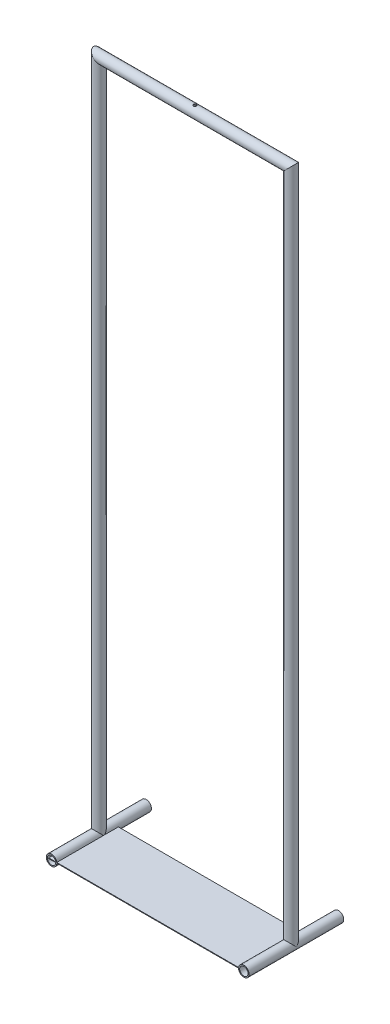
from build123d import *

# Parameters (mm, degrees)
SKETCH11_R                           = 16.7005
SKETCH11_R_2                         = 13.3223
PIPE_CONFIGURED_1_0_SCH_40_1_DEPTH   = 2158.218073598
SKETCH11_ON_SEGMENT_2_R              = 16.7005
SKETCH11_ON_SEGMENT_2_R_2            = 13.3223
PIPE_CONFIGURED_1_0_SCH_40_1_2_DEPTH = 658.836147197
SKETCH11_ON_SEGMENT_3_R              = 16.7005
SKETCH11_ON_SEGMENT_3_R_2            = 13.3223
PIPE_CONFIGURED_1_0_SCH_40_1_3_DEPTH = 2158.218073598
SKETCH12_R                           = 16.7005
SKETCH12_R_2                         = 13.3223
PIPE_CONFIGURED_1_0_SCH_40_2_DEPTH   = 300
SKETCH12_ON_SEGMENT_2_R              = 16.7005
SKETCH12_ON_SEGMENT_2_R_2            = 13.3223
PIPE_CONFIGURED_1_0_SCH_40_2_2_DEPTH = 300
CUT_EXTRUDE2_START                   = -34
CUT_EXTRUDE2_OUTLINE_R               = 5
CUT_EXTRUDE2_DEPTH                   = 35
SKETCH15_W                           = 601.909903741
SKETCH15_H                           = 195.259888428
BOSS_EXTRUDE1_DEPTH                  = 2


with BuildPart() as part:
    # Sketch11 → Pipe - configured 1.0 SCH 40(1) (new body)
    with BuildSketch(Plane(origin=(-1209.488751956, -1711.666086539, 0), x_dir=(-1, 0, 0), z_dir=(0, 1, 0))):
        Circle(SKETCH11_R)
        Circle(SKETCH11_R_2, mode=Mode.SUBTRACT)
    extrude(amount=PIPE_CONFIGURED_1_0_SCH_40_1_DEPTH)

    # Pipe - configured 1.0 SCH 40(1) mitre 1
    split(bisect_by=Plane(origin=(-1209.488751956, 421.933913461, 0), x_dir=(0.707106781, -0.707106781, 0), z_dir=(-0.707106781, -0.707106781, 0)), keep=Keep.TOP)


with BuildPart() as body_2:
    # Sketch11 on segment 2 (carried to segment 2) → Pipe - configured 1.0 SCH 40_1 2 (new body)
    with BuildSketch(Plane(origin=(-1234.106825554, 421.933913461, 0), x_dir=(0, 1, 0), z_dir=(1, 0, 0))):
        Circle(SKETCH11_ON_SEGMENT_2_R)
        Circle(SKETCH11_ON_SEGMENT_2_R_2, mode=Mode.SUBTRACT)
    extrude(amount=PIPE_CONFIGURED_1_0_SCH_40_1_2_DEPTH)

    # Pipe - configured 1.0 SCH 40_1 2 mitre 1
    split(bisect_by=Plane(origin=(-1209.488751956, 421.933913461, 0), x_dir=(-0.707106781, 0.707106781, 0), z_dir=(0.707106781, 0.707106781, 0)), keep=Keep.TOP)

    # Pipe - configured 1.0 SCH 40_1 2 mitre 2
    split(bisect_by=Plane(origin=(-599.888751956, 421.933913461, 0), x_dir=(-0.707106781, -0.707106781, 0), z_dir=(-0.707106781, 0.707106781, 0)), keep=Keep.TOP)

    # Cut-Extrude2: read off the stored shape, not the designer's step
    # Cut-Extrude2 outline → Cut-Extrude2 (cut)
    with BuildSketch(Plane(origin=(0, 438.633719211, 0), x_dir=(1, 0, 0), z_dir=(0, 1, 0)).offset(CUT_EXTRUDE2_START)):
        with Locations((-904.688751956, 0)):
            Circle(CUT_EXTRUDE2_OUTLINE_R)
    extrude(amount=CUT_EXTRUDE2_DEPTH, mode=Mode.SUBTRACT)


with BuildPart() as body_3:
    # Sketch11 on segment 3 (carried to segment 3) → Pipe - configured 1.0 SCH 40_1 3 (new body)
    with BuildSketch(Plane(origin=(-599.888751956, 446.551987059, 0), x_dir=(1, 0, 0), z_dir=(0, -1, 0))):
        Circle(SKETCH11_ON_SEGMENT_3_R)
        Circle(SKETCH11_ON_SEGMENT_3_R_2, mode=Mode.SUBTRACT)
    extrude(amount=PIPE_CONFIGURED_1_0_SCH_40_1_3_DEPTH)

    # Pipe - configured 1.0 SCH 40_1 3 mitre 1
    split(bisect_by=Plane(origin=(-599.888751956, 421.933913461, 0), x_dir=(0.707106781, 0.707106781, 0), z_dir=(0.707106781, -0.707106781, 0)), keep=Keep.TOP)


with BuildPart() as body_4:
    # Sketch12 → Pipe - configured 1.0 SCH 40(2) (new body)
    with BuildSketch(Plane(origin=(-599.888751956, -1711.666086539, 150), x_dir=(1, 0, 0), z_dir=(0, 0, -1))):
        Circle(SKETCH12_R)
        Circle(SKETCH12_R_2, mode=Mode.SUBTRACT)
    extrude(amount=PIPE_CONFIGURED_1_0_SCH_40_2_DEPTH)


with BuildPart() as body_5:
    # Sketch12 on segment 2 (carried to segment 2) → Pipe - configured 1.0 SCH 40_2 2 (new body)
    with BuildSketch(Plane(origin=(-1209.488751956, -1711.666086539, 150), x_dir=(1, 0, 0), z_dir=(0, 0, -1))):
        Circle(SKETCH12_ON_SEGMENT_2_R)
        Circle(SKETCH12_ON_SEGMENT_2_R_2, mode=Mode.SUBTRACT)
    extrude(amount=PIPE_CONFIGURED_1_0_SCH_40_2_2_DEPTH)


with BuildPart() as body_6:
    # Sketch15 → Boss-Extrude1 (new body)
    with BuildSketch(Plane(origin=(0, -1711.666086539, 0), x_dir=(1, 0, 0), z_dir=(0, 1, 0))):
        with Locations((-917.544203827, -52.370055786)):
            Rectangle(SKETCH15_W, SKETCH15_H)
    extrude(amount=BOSS_EXTRUDE1_DEPTH)


solid = Compound([part.part, body_2.part, body_3.part, body_4.part, body_5.part, body_6.part])
